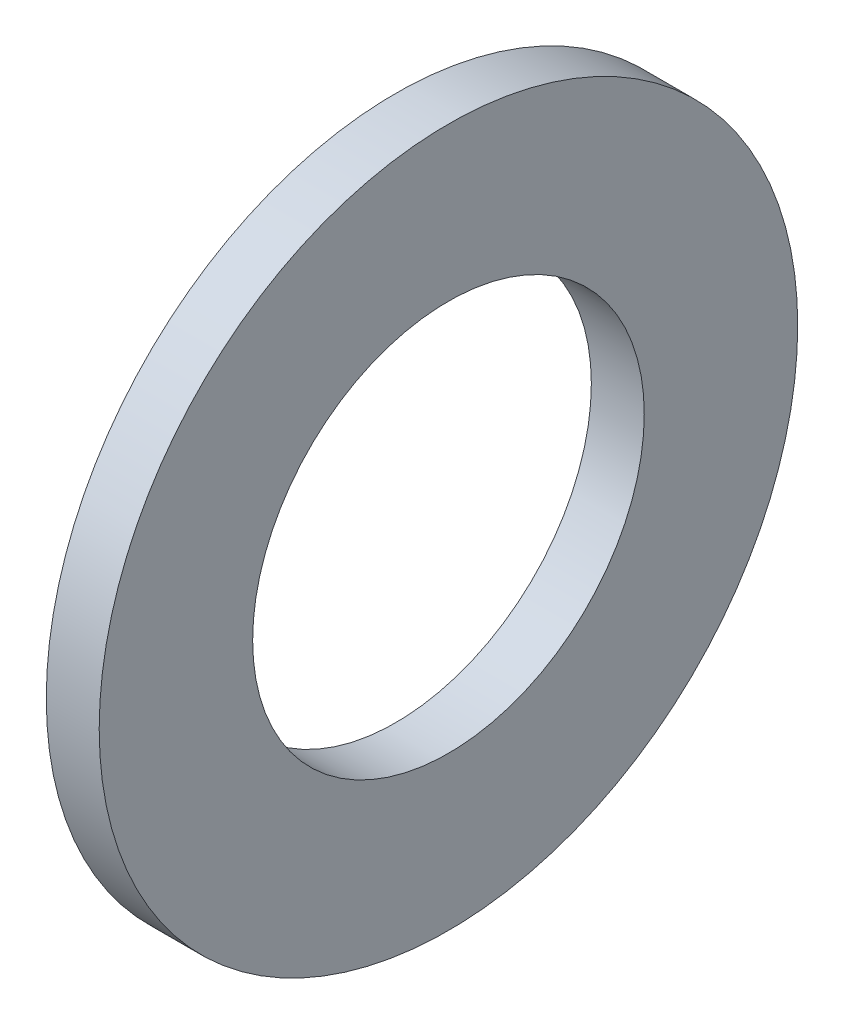
from build123d import *

# Parameters (mm, degrees)
SKETCH1_W = 5
SKETCH1_H = 14.5


with BuildPart() as part:
    # Sketch1 → Base-Revolve (revolve)
    with BuildSketch(Plane.XY):
        with Locations((-2.5, 25.75)):
            Rectangle(SKETCH1_W, SKETCH1_H)
    revolve(axis=Axis((-34.925, 0, 0), (1, 0, 0)))


solid = part.part
